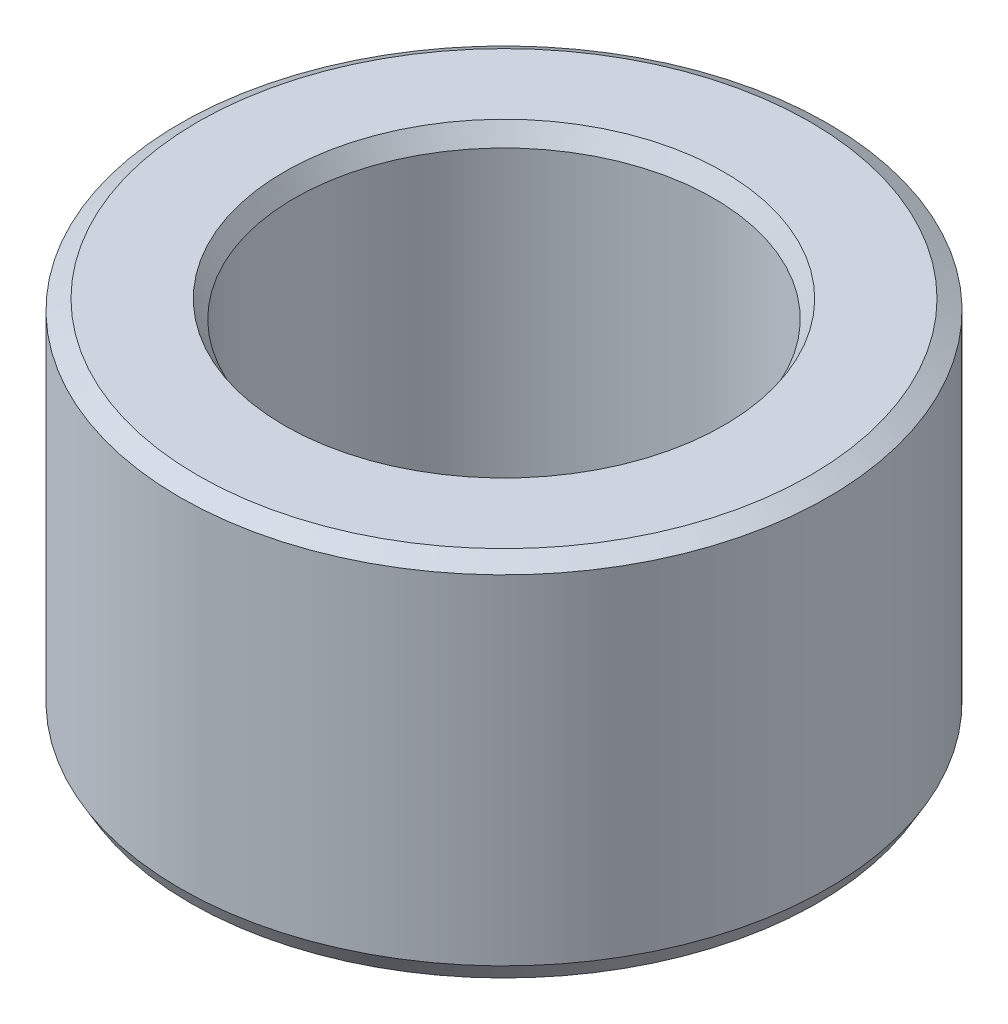
from build123d import *
from OCP.BRepFilletAPI import BRepFilletAPI_MakeChamfer

# Parameters (mm, degrees)
SKETCH1_R           = 50
BOSS_EXTRUDE1_DEPTH = 56.584841402
SKETCH2_R           = 32.34061424
CUT_EXTRUDE1_DEPTH  = 91.564034122
CHAMFER1_SIZE       = 1.57666623
CHAMFER1_SIZE2      = 2.730866017


with BuildPart() as part:
    # Sketch1 → Boss-Extrude1 (new body)
    with BuildSketch(Plane(origin=(0, 0, 0), x_dir=(1, 0, 0), z_dir=(0, 1, 0))):
        Circle(SKETCH1_R)
    extrude(amount=BOSS_EXTRUDE1_DEPTH)

    # Sketch2 → Cut-Extrude1 (cut, through all)
    with BuildSketch(Plane(origin=(0, 0, 0), x_dir=(1, 0, 0), z_dir=(0, 1, 0))):
        Circle(SKETCH2_R)
    extrude(amount=CUT_EXTRUDE1_DEPTH, mode=Mode.SUBTRACT)

    # Chamfer1: one chamfer whose edges measure the first distance from different faces: ONE call of the kernel's chamfer builder (chamfer() names one face for all edges)
    chamfer1_edges_1 = [part.edges().sort_by_distance(p)[0] for p in [
        (-32.34061424, 56.584841402, 0),
    ]]
    chamfer1_side_1 = [part.faces().sort_by_distance(p)[0] for p in [
        (-48.585786438, 56.584841402, 0),
    ]]
    chamfer1_edges_2 = [part.edges().sort_by_distance(p)[0] for p in [
        (-32.34061424, 0, 0),
    ]]
    chamfer1_side_2 = [part.faces().sort_by_distance(p)[0] for p in [
        (-32.34061424, 28.292420701, 0),
    ]]
    chamfer1_edges_3 = [part.edges().sort_by_distance(p)[0] for p in [
        (-50, 0, 0),
    ]]
    chamfer1_side_3 = [part.faces().sort_by_distance(p)[0] for p in [
        (-48.585786438, 0, 0),
    ]]
    chamfer1_edges_4 = [part.edges().sort_by_distance(p)[0] for p in [
        (-50, 56.584841402, 0),
    ]]
    chamfer1_side_4 = [part.faces().sort_by_distance(p)[0] for p in [
        (-50, 28.292420701, 0),
    ]]
    chamfer1 = BRepFilletAPI_MakeChamfer(part.part.solid().wrapped)
    for e in chamfer1_edges_1:
        chamfer1.Add(CHAMFER1_SIZE, CHAMFER1_SIZE2, e.wrapped, chamfer1_side_1[0].wrapped)  # the first distance lies on this face
    for e in chamfer1_edges_2:
        chamfer1.Add(CHAMFER1_SIZE, CHAMFER1_SIZE2, e.wrapped, chamfer1_side_2[0].wrapped)  # the first distance lies on this face
    for e in chamfer1_edges_3:
        chamfer1.Add(CHAMFER1_SIZE, CHAMFER1_SIZE2, e.wrapped, chamfer1_side_3[0].wrapped)  # the first distance lies on this face
    for e in chamfer1_edges_4:
        chamfer1.Add(CHAMFER1_SIZE, CHAMFER1_SIZE2, e.wrapped, chamfer1_side_4[0].wrapped)  # the first distance lies on this face
    add(Compound.cast(chamfer1.Shape()), mode=Mode.REPLACE)


solid = part.part
